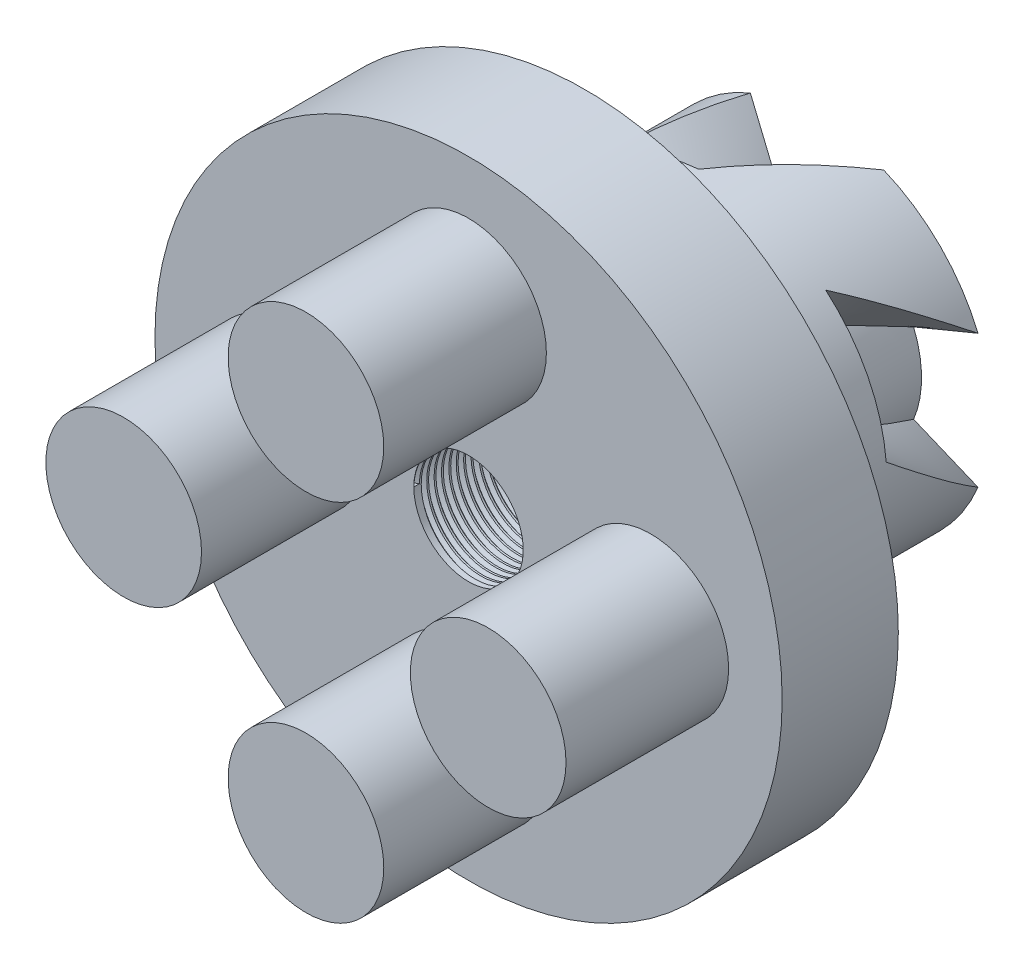
from build123d import *

# Parameters (mm, degrees)
SKETCH2_R           = 13.5
SKETCH2_R_2         = 3.35
BOSS_EXTRUDE1_DEPTH = 5
SKETCH2_3_R         = 3.35
BOSS_EXTRUDE2_DEPTH = 12
SKETCH3_R           = 2.355
CUT_EXTRUDE1_DEPTH  = 23.549944568
BOSS_EXTRUDE3_START = 10
SKETCH4_R           = 7.5
SKETCH4_R_2         = 2.355
BOSS_EXTRUDE3_DEPTH = 10
CUT_SWEEP1_PITCH    = 60
CIRPATTERN1_COUNT   = 4
THREAD1_PITCH       = 0.3175


with BuildPart() as part:
    # Sketch2 → Boss-Extrude1 (new body)
    # profile 1 of 5: a face of its own
    with BuildSketch(Plane.XY):
        Circle(SKETCH2_R)
        with Locations((-7.845, 0)):
            Circle(SKETCH2_R_2, mode=Mode.SUBTRACT)
        with Locations((0, -7.845)):
            Circle(SKETCH2_R_2, mode=Mode.SUBTRACT)
        with Locations((7.845, 0)):
            Circle(SKETCH2_R_2, mode=Mode.SUBTRACT)
        with Locations((0, 7.845)):
            Circle(SKETCH2_R_2, mode=Mode.SUBTRACT)
    # profile 2 of 5: a face of its own
    with BuildSketch(Plane.XY):
        with Locations((0, -7.845)):
            Circle(SKETCH2_R_2)
    # profile 3 of 5: a face of its own
    with BuildSketch(Plane.XY):
        with Locations((7.845, 0)):
            Circle(SKETCH2_R_2)
    # profile 4 of 5: a face of its own
    with BuildSketch(Plane.XY):
        with Locations((0, 7.845)):
            Circle(SKETCH2_R_2)
    # profile 5 of 5: a face of its own
    with BuildSketch(Plane.XY):
        with Locations((-7.845, 0)):
            Circle(SKETCH2_R_2)
    extrude(amount=BOSS_EXTRUDE1_DEPTH)

    # Sketch2<3> → Boss-Extrude2 (add)
    with BuildSketch(Plane.XY):
        with Locations((-7.845, 0)):
            Circle(SKETCH2_3_R)
        with Locations((0, 7.845)):
            Circle(SKETCH2_3_R)
        with Locations((7.845, 0)):
            Circle(SKETCH2_3_R)
        with Locations((0, -7.845)):
            Circle(SKETCH2_3_R)
    extrude(amount=BOSS_EXTRUDE2_DEPTH)

    # Sketch3 → Cut-Extrude1 (cut, through all)
    with BuildSketch(Plane(origin=(0, 0, 0), x_dir=(-1, 0, 0), z_dir=(0, 0, -1))):
        Circle(SKETCH3_R)
    extrude(amount=-CUT_EXTRUDE1_DEPTH, mode=Mode.SUBTRACT)

    # Sketch4 → Boss-Extrude3 (add)
    with BuildSketch(Plane(origin=(0, 0, 0), x_dir=(-1, 0, 0), z_dir=(0, 0, -1)).offset(BOSS_EXTRUDE3_START)):
        Circle(SKETCH4_R)
        Circle(SKETCH4_R_2, mode=Mode.SUBTRACT)
    extrude(amount=-BOSS_EXTRUDE3_DEPTH)

    # Cut-Sweep1: arcs per turn and ends read off the stored shape
    # Cut-Sweep1: the profile of Sketch5 screwed along a right-hand helix through 1.075008 turns, 28 arcs to a turn; built about Z, then put on its axis
    cut_sweep1_z = Axis((0, 0, 0), (0, 0, 1))
    cut_sweep1_corners = [(4.157457896, -1.722075446, -60), (6.929096494, -2.870125743, -60), (6.929096494, 2.870125743, -60), (4.157457896, 1.722075446, -60)]
    with BuildLine(mode=Mode.PRIVATE) as cut_sweep1_profile:
        Line(cut_sweep1_corners[0], cut_sweep1_corners[1])
        Line(cut_sweep1_corners[2], cut_sweep1_corners[3])
        ThreePointArc((6.929096494, -2.870125743, -60), (7.5, 0, -60), (6.929096494, 2.870125743, -60))
        ThreePointArc((4.157457896, 1.722075446, -60), (4.5, 0, -60), (4.157457896, -1.722075446, -60))
    cut_sweep1_cap = Face(cut_sweep1_profile.wire())
    cut_sweep1_arcs = [((6.929096494, -2.870125743, -60), (8.117941502, 0, -60), (6.929096494, 2.870125743, -60), (1, 0.9238795325112885, 1)), ((4.157457896, 1.722075446, -60), (4.870764901, 0, -60), (4.157457896, -1.722075446, -60), (1, 0.9238795325112878, 1))]  # start, shoulder, end, weights
    cut_sweep1_turn_angles = [0, 6.428571429, 12.857142857, 19.285714286, 25.714285714, 32.142857143, 38.571428571, 45, 51.428571429, 57.857142857, 64.285714286, 70.714285714, 77.142857143, 83.571428571, 90, 96.428571429, 102.857142857, 109.285714286, 115.714285714, 122.142857143, 128.571428571, 135, 141.428571429, 147.857142857, 154.285714286, 160.714285714, 167.142857143, 173.571428571, 180, 186.428571429, 192.857142857, 199.285714286, 205.714285714, 212.142857143, 218.571428571, 225, 231.428571429, 237.857142857, 244.285714286, 250.714285714, 257.142857143, 263.571428571, 270, 276.428571429, 282.857142857, 289.285714286, 295.714285714, 302.142857143, 308.571428571, 315, 321.428571429, 327.857142857, 334.285714286, 340.714285714, 347.142857143, 353.571428571, 360]
    cut_sweep1_turn_weights = [1, 0.9937122098932426, 1, 0.9937122098932426, 1, 0.9937122098932426, 1, 0.9937122098932426, 1, 0.9937122098932426, 1, 0.9937122098932426, 1, 0.9937122098932426, 1, 0.9937122098932426, 1, 0.9937122098932426, 1, 0.9937122098932426, 1, 0.9937122098932426, 1, 0.9937122098932426, 1, 0.9937122098932426, 1, 0.9937122098932426, 1, 0.9937122098932426, 1, 0.9937122098932426, 1, 0.9937122098932426, 1, 0.9937122098932426, 1, 0.9937122098932426, 1, 0.9937122098932426, 1, 0.9937122098932426, 1, 0.9937122098932426, 1, 0.9937122098932426, 1, 0.9937122098932426, 1, 0.9937122098932426, 1, 0.9937122098932426, 1, 0.9937122098932426, 1, 0.9937122098932426, 1]
    cut_sweep1_turn_rails = [Edge.make_bspline([Vector(p[0], p[1], 0).rotate(cut_sweep1_z, cut_sweep1_turn_angles[k]) / cut_sweep1_turn_weights[k] + Vector(0, 0, p[2] + CUT_SWEEP1_PITCH * cut_sweep1_turn_angles[k] / 360) for k in range(57)], [0, 0, 0, 1, 1, 2, 2, 3, 3, 4, 4, 5, 5, 6, 6, 7, 7, 8, 8, 9, 9, 10, 10, 11, 11, 12, 12, 13, 13, 14, 14, 15, 15, 16, 16, 17, 17, 18, 18, 19, 19, 20, 20, 21, 21, 22, 22, 23, 23, 24, 24, 25, 25, 26, 26, 27, 27, 28, 28, 28], 2, cut_sweep1_turn_weights) for p in cut_sweep1_corners]
    cut_sweep1_turn_sides = [*[Face.make_surface_from_curves(cut_sweep1_turn_rails[p[0]], cut_sweep1_turn_rails[p[1]]) for p in [(0, 1), (2, 3)]], *[Face.make_bezier_surface([[Vector(p[j][0], p[j][1], 0).rotate(cut_sweep1_z, cut_sweep1_turn_angles[2 * i + k]) / cut_sweep1_turn_weights[2 * i + k] + Vector(0, 0, p[j][2] + CUT_SWEEP1_PITCH * cut_sweep1_turn_angles[2 * i + k] / 360) for k in range(3)] for j in range(3)], [[p[3][j] * cut_sweep1_turn_weights[2 * i + k] for k in range(3)] for j in range(3)]) for p in cut_sweep1_arcs for i in range(28)]]
    cut_sweep1_last_angles = [360, 366.428571429, 372.857142857, 379.285714286, 385.714285714, 386.358642857, 387.003]
    cut_sweep1_last_weights = [1, 0.9937122098932426, 1, 0.9937122098932426, 1, 0.9999367626799643, 1]
    cut_sweep1_last_rails = [Edge.make_bspline([Vector(p[0], p[1], 0).rotate(cut_sweep1_z, cut_sweep1_last_angles[k]) / cut_sweep1_last_weights[k] + Vector(0, 0, p[2] + CUT_SWEEP1_PITCH * cut_sweep1_last_angles[k] / 360) for k in range(7)], [0, 0, 0, 1, 1, 2, 2, 3, 3, 3], 2, cut_sweep1_last_weights) for p in cut_sweep1_corners]
    cut_sweep1_last_sides = [*[Face.make_surface_from_curves(cut_sweep1_last_rails[p[0]], cut_sweep1_last_rails[p[1]]) for p in [(0, 1), (2, 3)]], *[Face.make_bezier_surface([[Vector(p[j][0], p[j][1], 0).rotate(cut_sweep1_z, cut_sweep1_last_angles[2 * i + k]) / cut_sweep1_last_weights[2 * i + k] + Vector(0, 0, p[j][2] + CUT_SWEEP1_PITCH * cut_sweep1_last_angles[2 * i + k] / 360) for k in range(3)] for j in range(3)], [[p[3][j] * cut_sweep1_last_weights[2 * i + k] for k in range(3)] for j in range(3)]) for p in cut_sweep1_arcs for i in range(3)]]
    cut_sweep1 = Plane(origin=(0, 0, -10), x_dir=(0, 1, 0), z_dir=(0, 0, 1)) * Solid(Shell([*cut_sweep1_turn_sides, *cut_sweep1_last_sides, cut_sweep1_cap, cut_sweep1_cap.rotate(cut_sweep1_z, 387.003).moved(Location((0, 0, CUT_SWEEP1_PITCH * 387.003 / 360)))]))
    add(cut_sweep1, mode=Mode.SUBTRACT)

    # CirPattern1: Cut-Sweep1 ×4 about axis
    cirpattern1_axis = Axis((0, 0, 12), (0, 0, -1))
    for i in range(1, CIRPATTERN1_COUNT):
        add(cut_sweep1.rotate(cirpattern1_axis, i * 360 / CIRPATTERN1_COUNT), mode=Mode.SUBTRACT)

    # Thread1: arcs per turn and ends read off the stored shape
    # Thread1: the profile of Thread Profile1 profile screwed along a right-hand helix through 47.244094 turns, 6 arcs to a turn; built about Z, then put on its axis
    thread1_z = Axis((0, 0, 0), (0, 0, 1))
    thread1_corners = [(2.3547, 0, -0.000173205), (2.526851915, 0, 0.09921875), (2.526851915, 0, 0.13890625), (2.3547, 0, 0.238298204)]
    with BuildLine(mode=Mode.PRIVATE) as thread1_profile:
        Line(thread1_corners[0], thread1_corners[1])
        Line(thread1_corners[1], thread1_corners[2])
        Line(thread1_corners[2], thread1_corners[3])
        Line(thread1_corners[3], thread1_corners[0])
    thread1_cap = Face(thread1_profile.wire())
    thread1_turn_angles = [0, 30, 60, 90, 120, 150, 180, 210, 240, 270, 300, 330, 360]
    thread1_turn_weights = [1, 0.8660254037844387, 1, 0.8660254037844387, 1, 0.8660254037844387, 1, 0.8660254037844387, 1, 0.8660254037844387, 1, 0.8660254037844387, 1]
    thread1_turn_rails = [Edge.make_bspline([Vector(p[0], p[1], 0).rotate(thread1_z, thread1_turn_angles[k]) / thread1_turn_weights[k] + Vector(0, 0, p[2] + THREAD1_PITCH * thread1_turn_angles[k] / 360) for k in range(13)], [0, 0, 0, 1, 1, 2, 2, 3, 3, 4, 4, 5, 5, 6, 6, 6], 2, thread1_turn_weights) for p in thread1_corners]
    thread1_turn_sides = [Face.make_surface_from_curves(thread1_turn_rails[p[0]], thread1_turn_rails[p[1]]) for p in [(0, 1), (1, 2), (2, 3), (3, 0)]]
    thread1_last_angles = [16920, 16950, 16980, 16993.937007874, 17007.874015748]
    thread1_last_weights = [1, 0.8660254037844387, 1, 0.9705611135832155, 1]
    thread1_last_rails = [Edge.make_bspline([Vector(p[0], p[1], 0).rotate(thread1_z, thread1_last_angles[k]) / thread1_last_weights[k] + Vector(0, 0, p[2] + THREAD1_PITCH * thread1_last_angles[k] / 360) for k in range(5)], [0, 0, 0, 1, 1, 2, 2, 2], 2, thread1_last_weights) for p in thread1_corners]
    thread1_last_sides = [Face.make_surface_from_curves(thread1_last_rails[p[0]], thread1_last_rails[p[1]]) for p in [(0, 1), (1, 2), (2, 3), (3, 0)]]
    thread1 = Plane(origin=(0, 0, 5), x_dir=(-1, 0, 0), z_dir=(0, 0, -1)) * Solid(Shell([*[p.moved(Location((0, 0, THREAD1_PITCH * i))) for i in range(47) for p in thread1_turn_sides], *thread1_last_sides, thread1_cap, thread1_cap.rotate(thread1_z, 17007.874015748).moved(Location((0, 0, THREAD1_PITCH * 17007.874015748 / 360)))]))
    add(thread1, mode=Mode.SUBTRACT)


solid = part.part
